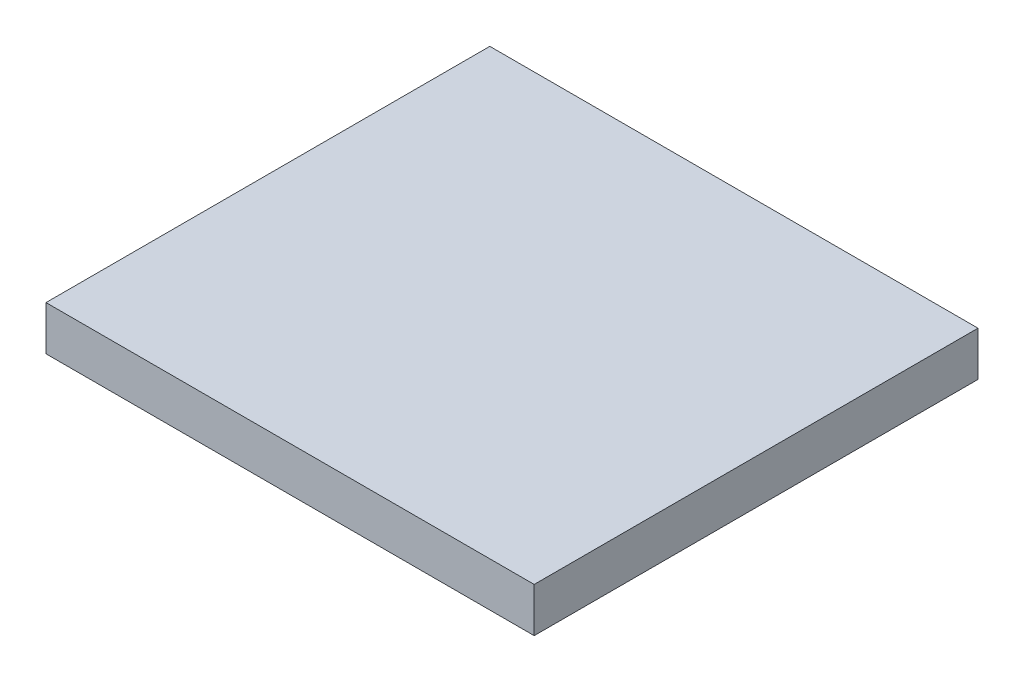
from build123d import *

# Parameters (mm, degrees)
SKETCH1_W           = 220
SKETCH1_H           = 200
BOSS_EXTRUDE1_DEPTH = 20


with BuildPart() as part:
    # Sketch1 → Boss-Extrude1 (new body)
    with BuildSketch(Plane(origin=(0, 0, 0), x_dir=(1, 0, 0), z_dir=(0, 1, 0))):
        Rectangle(SKETCH1_W, SKETCH1_H)
    extrude(amount=BOSS_EXTRUDE1_DEPTH)


solid = part.part
